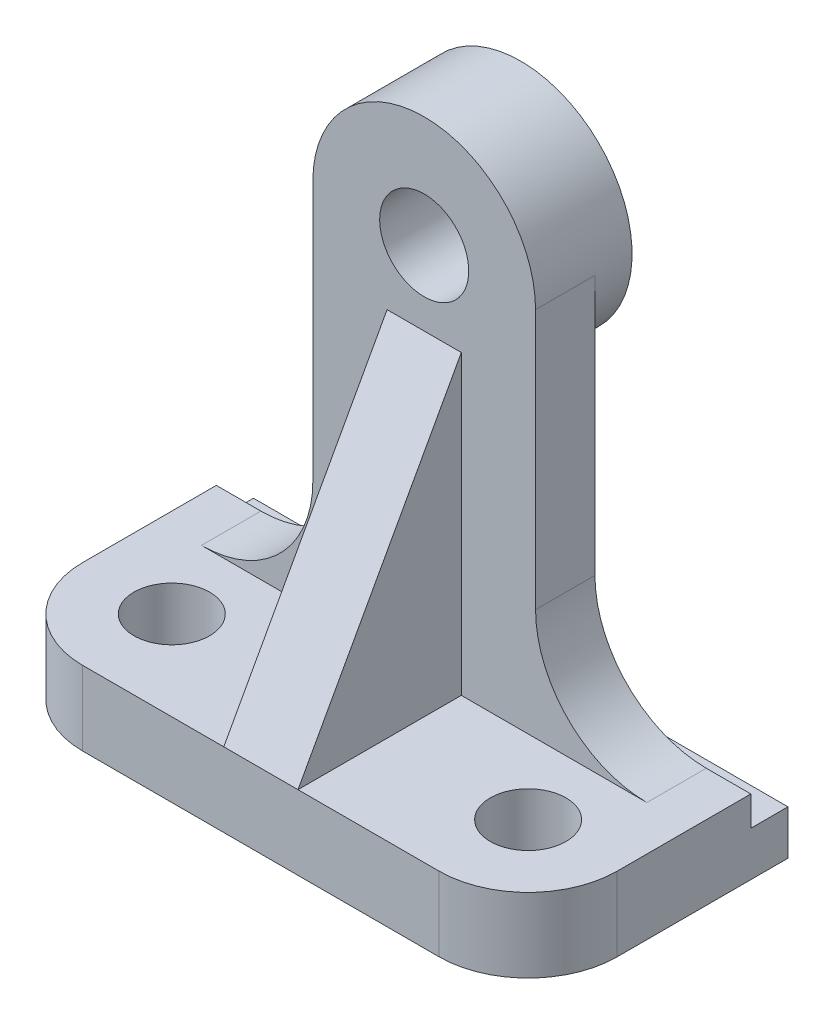
from build123d import *
from build123d.topology import SkipClean

# Parameters (mm, degrees)
SKETCH1_W                    = 72
SKETCH1_H                    = 35
BOSS_EXTRUDE1_DEPTH          = 10
FILLET1_R                    = 12
CUT_EXTRUDE1_DEPTH           = 42.258332492
CUT_EXTRUDE1_DEPTH_BACK      = 42.258332492
SKETCH2_W                    = 5
SKETCH2_H                    = 4
M12_TAPPED_HOLE1_D           = 10.2
M12_TAPPED_HOLE1_CSINK_D     = 12.05
M12_TAPPED_HOLE1_CSINK_ANGLE = 90
SKETCH6_R                    = 6
BOSS_EXTRUDE2_DEPTH          = 8
FILLET2_R                    = 15
BOSS_EXTRUDE3_START          = 5
SKETCH7_R                    = 15
SKETCH7_R_2                  = 6
BOSS_EXTRUDE3_DEPTH          = 5
RIB5_START                   = -5
RIB5_DEPTH                   = 10


# Read off the part's stored shape, not the designer's step: Rib5
with BuildPart() as part:
    # Sketch1 → Boss-Extrude1 (new body)
    with BuildSketch(Plane(origin=(0, 0, 0), x_dir=(1, 0, 0), z_dir=(0, 1, 0))):
        Rectangle(SKETCH1_W, SKETCH1_H)
    extrude(amount=BOSS_EXTRUDE1_DEPTH)

    # Fillet1
    fillet1_edges = [part.edges().sort_by_distance(p)[0] for p in [
        (36, 5, 17.5),
        (-36, 5, 17.5),
    ]]
    fillet(fillet1_edges, radius=FILLET1_R)

    # Sketch2 → Cut-Extrude1 (cut, two sides: drawn at the far end of the back side and taken through both)
    with BuildSketch(Plane(origin=(0, 0, 0), x_dir=(0, 0, -1), z_dir=(1, 0, 0)).offset(-CUT_EXTRUDE1_DEPTH_BACK)):
        with Locations((15, 8)):
            Rectangle(SKETCH2_W, SKETCH2_H)
    extrude(amount=CUT_EXTRUDE1_DEPTH + CUT_EXTRUDE1_DEPTH_BACK, mode=Mode.SUBTRACT)

    # M12 Tapped Hole1 (through all)
    with Locations(Plane.XZ):
        with Locations((-24, 5.5), (24, 5.5)):
            CounterSinkHole(M12_TAPPED_HOLE1_D / 2, M12_TAPPED_HOLE1_CSINK_D / 2, counter_sink_angle=M12_TAPPED_HOLE1_CSINK_ANGLE)

    # Sketch6 → Boss-Extrude2 (add)
    with BuildSketch(Plane(origin=(0, 0, -12.5), x_dir=(-1, 0, 0), z_dir=(0, 0, -1))):
        with BuildLine():
            Line((15, 10), (-15, 10))
            Line((-15, 10), (-15, 60))
            ThreePointArc((-15, 60), (0, 75), (15, 60))
            Line((15, 60), (15, 10))
        make_face()
        with Locations((0, 60)):
            Circle(SKETCH6_R, mode=Mode.SUBTRACT)
    extrude(amount=-BOSS_EXTRUDE2_DEPTH)

    # Fillet2
    fillet2_edges = [part.edges().sort_by_distance(p)[0] for p in [
        (-15, 10, -8.5),
        (15, 10, -8.5),
    ]]
    fillet(fillet2_edges, radius=FILLET2_R)

    # Sketch7 → Boss-Extrude3 (add)
    with SkipClean():  # the faces are left unmerged after this step: merging them gives an invalid solid
        with BuildSketch(Plane(origin=(0, 0, -12.5), x_dir=(-1, 0, 0), z_dir=(0, 0, -1)).offset(BOSS_EXTRUDE3_START)):
            with Locations((0, 60)):
                Circle(SKETCH7_R)
            with Locations((0, 60)):
                Circle(SKETCH7_R_2, mode=Mode.SUBTRACT)
        extrude(amount=-BOSS_EXTRUDE3_DEPTH)

    # Rib5 outline → Rib5 (add)
    with SkipClean():  # the faces are left unmerged after this step: merging them gives an invalid solid
        with BuildSketch(Plane(origin=(0, 0, 0), x_dir=(0, 0, -1), z_dir=(1, 0, 0)).offset(RIB5_START)):
            Polygon((4.5, 50), (-17.5, 10), (4.5, 10), align=None)
        extrude(amount=RIB5_DEPTH)


solid = part.part
